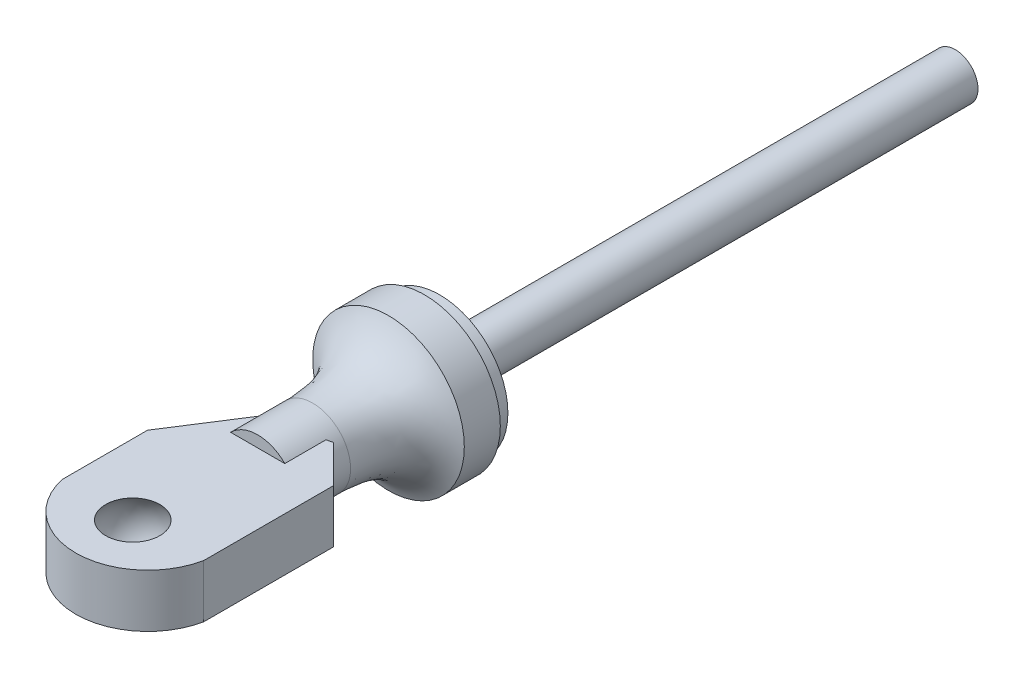
from build123d import *

# Parameters (mm, degrees)
SKETCH1_R            = 1.5
SHAFT_DEPTH          = 34
BALL_STICK_DEPTH     = 1.75
STICK_CHAMFER_SIZE   = 2.519422
STICK_CHAMFER_SIZE_2 = 3
STICK_CHAMFER_SIZE_3 = 3.932026


with BuildPart() as part:
    # Sketch1 → Shaft (new body)
    with BuildSketch(Plane.XY):
        Circle(SKETCH1_R)
    extrude(amount=SHAFT_DEPTH)

    # Sketch2 → Taper (revolve)
    with BuildSketch(Plane(origin=(0, 0, 0), x_dir=(0, 0, -1), z_dir=(1, 0, 0)), mode=Mode.PRIVATE) as taper_sk:
        with BuildLine():
            Line((-34, 0), (-34, 4.5))
            Line((-34, 4.5), (-35, 4.5))
            Line((-35, 4.5), (-35, 5))
            Line((-35, 5), (-37.374742, 5))
            add(Edge.make_bspline(
                [(-37.374742, 5), (-38.253207, 3.070617), (-40.048162, 2.5), (-42.374742, 2.5)],
                knots=[0, 0, 0, 0, 1, 1, 1, 1], degree=3))
            Line((-42.374742, 2.5), (-46, 2.5))
            Line((-46, 2.5), (-46, 0))
            Line((-46, 0), (-34, 0))
        make_face()
    revolve(taper_sk.sketch.rotate(Axis((0, 0, 46), (0, 0, -1)), 90), axis=Axis((0, 0, 46), (0, 0, -1)))

    # Sketch3 → Ball Stick (add, symmetric)
    with BuildSketch(Plane(origin=(0, 0, 0), x_dir=(1, 0, 0), z_dir=(0, 1, 0))):
        with BuildLine():
            Line((-4.645867, -44.688664), (-4.645867, -54.239171))
            ThreePointArc((-4.645867, -54.239171), (0.014074, -58), (4.651647, -54.211622))
            Line((4.651647, -54.211622), (4.651647, -42.652888))
            Line((4.651647, -42.652888), (-4.645867, -44.688664))
        make_face()
    extrude(amount=BALL_STICK_DEPTH, both=True)

    # Stick Chamfer
    # the kernel refuses this chamfer: 3.932026, 3, 2.519422 mm, written as the material it takes off along each edge
    with BuildSketch(Plane(origin=(4.651647, -9.465049, 42.652888), x_dir=(-0.9844681197445659, 0, 0.17556343926512386), z_dir=(0, 1, 0))) as stick_chamfer_piece_1_section:
        Polygon((STICK_CHAMFER_SIZE * 0.999236505446, STICK_CHAMFER_SIZE * 0.0390692513833), (STICK_CHAMFER_SIZE_2 * 0.175563439265, STICK_CHAMFER_SIZE_2 * 0.984468119745), (0, 0), align=None)
    stick_chamfer_piece_1 = extrude(amount=18.930098, mode=Mode.PRIVATE)
    stick_chamfer_piece_1 = stick_chamfer_piece_1 - Plane(origin=(0, 0, 43.826032), x_dir=(1, 0, 0), z_dir=(0, 0, 1)) * Cylinder(2.5, 50, mode=Mode.PRIVATE)
    add(stick_chamfer_piece_1, mode=Mode.SUBTRACT)
    with BuildSketch(Plane(origin=(-4.645867, -11.91335, 44.688664), x_dir=(0.9685928685893737, 0, -0.2486520760375998), z_dir=(0, 1, 0))) as stick_chamfer_piece_2_section:
        Polygon((STICK_CHAMFER_SIZE_2 * 0.999361711808, -STICK_CHAMFER_SIZE_2 * 0.0357235072801), (-STICK_CHAMFER_SIZE_3 * 0.248652076055, -STICK_CHAMFER_SIZE_3 * 0.968592868659), (0, 0), align=None)
    stick_chamfer_piece_2 = extrude(amount=23.826699, mode=Mode.PRIVATE)
    stick_chamfer_piece_2 = stick_chamfer_piece_2 - Plane(origin=(0, 0, 45.795784), x_dir=(1, 0, 0), z_dir=(0, 0, 1)) * Cylinder(2.5, 63, mode=Mode.PRIVATE)
    add(stick_chamfer_piece_2, mode=Mode.SUBTRACT)

    # Sketch4 → Ball Hole (revolve, cut)
    with BuildSketch(Plane(origin=(0, 0, 0), x_dir=(0, 0, -1), z_dir=(1, 0, 0))):
        with BuildLine():
            Line((-54.239171, -1.75), (-54.239171, 1.75))
            Line((-54.239171, 1.75), (-56.024528, 1.75))
            ThreePointArc((-56.024528, 1.75), (-56.739171, 0), (-56.024528, -1.75))
            Line((-56.024528, -1.75), (-54.239171, -1.75))
        make_face()
    revolve(axis=Axis((0, -1.75, 54.239171), (0, 1, 0)), mode=Mode.SUBTRACT)


solid = part.part
